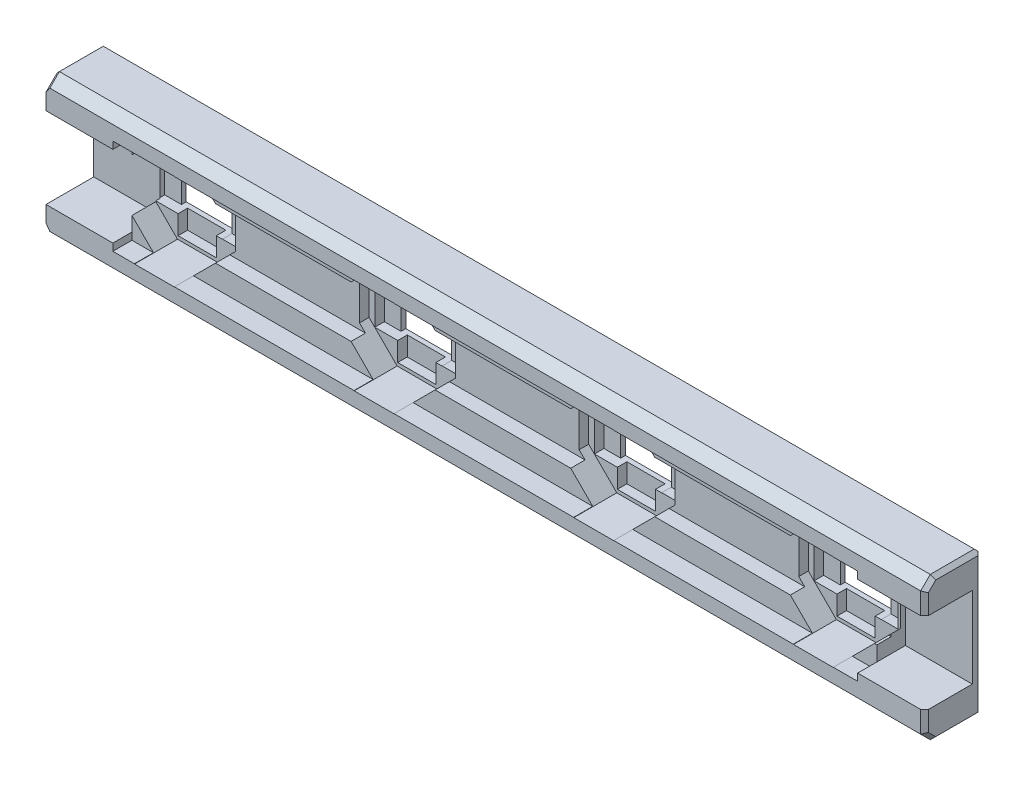
from build123d import *

# Parameters (mm, degrees)
SKETCH1_W                = 92
SKETCH1_H                = 15
BOSS_EXTRUDE1_DEPTH      = 6
CUT_EXTRUDE8_DEPTH       = 92
SKETCH13_W               = 0.5
SKETCH13_H               = 10
CUT_EXTRUDE9_DEPTH       = 0.6
FILLET1_R                = 0.25
FILLET2_R                = 0.25
CHAMFER1_SIZE            = 0.4
CHAMFER2_SIZE            = 0.4
CHAMFER3_SIZE            = 0.4
CHAMFER4_SIZE            = 0.4
CHAMFER5_SIZE            = 0.4
CUT_EXTRUDE10_DEPTH      = 4.5
SKETCH16_W               = 5.3
SKETCH16_H               = 5.3
CUT_EXTRUDE11_DEPTH      = 4.5
SKETCH17_W               = 4
SKETCH17_H               = 2
CUT_EXTRUDE12_DEPTH      = 1
SKETCH18_W               = 1.75
SKETCH18_H               = 5.318073247
SKETCH18_H_2             = 5.281926753
CUT_EXTRUDE13_DEPTH      = 1
LPATTERN1_COUNT          = 4
LPATTERN1_PITCH          = 23
SKETCH19_W               = 7
SKETCH19_H               = 8.5
CUT_EXTRUDE14_DEPTH      = 5
SKETCH20_W               = 78
SKETCH20_H               = 10
CUT_EXTRUDE15_DEPTH      = 2
CUT_EXTRUDE16_DEPTH      = 80.806458515
CUT_EXTRUDE16_DEPTH_BACK = 80.806458515
SKETCH21_W               = 1.5
SKETCH21_H               = 5.392715996


with BuildPart() as part:
    # Sketch1 → Boss-Extrude1 (new body)
    with BuildSketch(Plane.XY):
        with Locations((0.25, 18.154296875)):
            Rectangle(SKETCH1_W, SKETCH1_H)
    extrude(amount=BOSS_EXTRUDE1_DEPTH)

    # Sketch12 → Cut-Extrude8 (cut)
    with BuildSketch(Plane(origin=(46.25, 0, 0), x_dir=(0, 0, -1), z_dir=(1, 0, 0))):
        Polygon((-6, 25.654296875), (-6, 24.654296875), (-5, 25.654296875), align=None)
        Polygon((-6, 10.654296875), (-5, 10.654296875), (-6, 11.654296875), align=None)
    extrude(amount=-CUT_EXTRUDE8_DEPTH, mode=Mode.SUBTRACT)

    # Sketch13 → Cut-Extrude9 (cut)
    with BuildSketch(Plane(origin=(0, 0, 0), x_dir=(-1, 0, 0), z_dir=(0, 0, -1))):
        with Locations((43.5, 18.154296875)):
            Rectangle(SKETCH13_W, SKETCH13_H)
    extrude(amount=-CUT_EXTRUDE9_DEPTH, mode=Mode.SUBTRACT)

    # Fillet1
    fillet1_edges = [part.edges().sort_by_distance(p)[0] for p in [
        (-43.75, 18.154296875, 0),
    ]]
    fillet(fillet1_edges, radius=FILLET1_R)

    # Fillet2
    fillet2_edges = [part.edges().sort_by_distance(p)[0] for p in [
        (-43.25, 18.154296875, 0.6),
        (-43.5, 23.154296875, 0.6),
        (-43.75, 18.154296875, 0.6),
        (-43.5, 13.154296875, 0.6),
    ]]
    fillet(fillet2_edges, radius=FILLET2_R - 0.0001)  # a hair under: the kernel refuses the full size

    # Chamfer1
    chamfer1_edges = [part.edges().sort_by_distance(p)[0] for p in [
        (0.25, 25.654296875, 0),
        (0.25, 10.654296875, 0),
    ]]
    chamfer(chamfer1_edges, length=CHAMFER1_SIZE)

    # Chamfer2
    chamfer2_edges = [part.edges().sort_by_distance(p)[0] for p in [
        (46.25, 18.154296875, 0),
        (-45.75, 18.154296875, 0),
    ]]
    chamfer(chamfer2_edges, length=CHAMFER2_SIZE)

    # Chamfer3
    chamfer3_edges = [part.edges().sort_by_distance(p)[0] for p in [
        (-45.75, 25.654296875, 2.7),
        (-45.75, 10.654296875, 2.7),
    ]]
    chamfer(chamfer3_edges, length=CHAMFER3_SIZE)

    # Chamfer4
    chamfer4_edges = [part.edges().sort_by_distance(p)[0] for p in [
        (-45.75, 11.354296875, 5.7),
        (-45.75, 24.954296875, 5.7),
    ]]
    chamfer(chamfer4_edges, length=CHAMFER4_SIZE)

    # Chamfer5
    chamfer5_edges = [part.edges().sort_by_distance(p)[0] for p in [
        (46.25, 18.154296875, 6),
        (46.25, 25.654296875, 2.7),
        (46.25, 10.654296875, 2.7),
        (46.25, 25.154296875, 5.5),
        (46.25, 11.154296875, 5.5),
    ]]
    chamfer(chamfer5_edges, length=CHAMFER5_SIZE)

    # Sketch15 → Cut-Extrude10 (cut)
    with BuildSketch(Plane.XY.offset(6)):
        Polygon((-29.382117138, 20.232772011), (-32.321524864, 23.172179737), (-36.478475136, 23.172179737), (-39.417882862, 20.232772011), (-39.417882862, 16.075821739), (-36.478475136, 13.136414013), (-32.321524864, 13.136414013), (-29.382117138, 16.075821739), align=None)
    cut_extrude10 = extrude(amount=-CUT_EXTRUDE10_DEPTH, mode=Mode.SUBTRACT)

    # Sketch16 → Cut-Extrude11 (cut)
    with BuildSketch(Plane.XY.offset(1.5)):
        with Locations((-34.417882862, 18.136414013)):
            Rectangle(SKETCH16_W, SKETCH16_H)
    cut_extrude11 = extrude(amount=-CUT_EXTRUDE11_DEPTH, mode=Mode.SUBTRACT)

    # Sketch17 → Cut-Extrude12 (cut)
    with BuildSketch(Plane.XY.offset(1.5)):
        with Locations((-34.417882862, 14.486414013)):
            Rectangle(SKETCH17_W, SKETCH17_H)
        with Locations((-34.417882862, 21.786414013)):
            Rectangle(SKETCH17_W, SKETCH17_H)
    cut_extrude12 = extrude(amount=-CUT_EXTRUDE12_DEPTH, mode=Mode.SUBTRACT)

    # Sketch18 → Cut-Extrude13 (cut)
    with BuildSketch(Plane.XY.offset(1.5)):
        with Locations((-37.942882862, 18.145450637)):
            Rectangle(SKETCH18_W, SKETCH18_H)
        with Locations((-30.892882862, 18.145450637)):
            Rectangle(SKETCH18_W, SKETCH18_H_2)
    cut_extrude13 = extrude(amount=-CUT_EXTRUDE13_DEPTH, mode=Mode.SUBTRACT)

    # LPattern1: Cut-Extrude10, Cut-Extrude11, Cut-Extrude12, Cut-Extrude13 ×4
    with Locations(*[(i * LPATTERN1_PITCH, 0, 0) for i in range(1, LPATTERN1_COUNT)]):
        add(cut_extrude10, mode=Mode.SUBTRACT)
        add(cut_extrude11, mode=Mode.SUBTRACT)
        add(cut_extrude12, mode=Mode.SUBTRACT)
        add(cut_extrude13, mode=Mode.SUBTRACT)

    # Sketch19 → Cut-Extrude14 (cut)
    with BuildSketch(Plane.XY.offset(6)):
        with Locations((-42.25, 18.154296875)):
            Rectangle(SKETCH19_W, SKETCH19_H)
        with Locations((42.75, 18.154296875)):
            Rectangle(SKETCH19_W, SKETCH19_H)
    extrude(amount=-CUT_EXTRUDE14_DEPTH, mode=Mode.SUBTRACT)

    # Sketch20 → Cut-Extrude15 (cut)
    with BuildSketch(Plane.XY.offset(6)):
        with Locations((0.25, 18.154296875)):
            Rectangle(SKETCH20_W, SKETCH20_H)
    extrude(amount=-CUT_EXTRUDE15_DEPTH, mode=Mode.SUBTRACT)

    # Sketch21 → Cut-Extrude16 (cut, two sides: drawn at the far end of the back side and taken through both)
    with BuildSketch(Plane(origin=(29.582117138, 0, 0), x_dir=(0, 0, -1), z_dir=(1, 0, 0)).offset(-CUT_EXTRUDE16_DEPTH_BACK)):
        with Locations((-3.25, 18.154296875)):
            Rectangle(SKETCH21_W, SKETCH21_H)
    extrude(amount=CUT_EXTRUDE16_DEPTH + CUT_EXTRUDE16_DEPTH_BACK, mode=Mode.SUBTRACT)


solid = part.part
